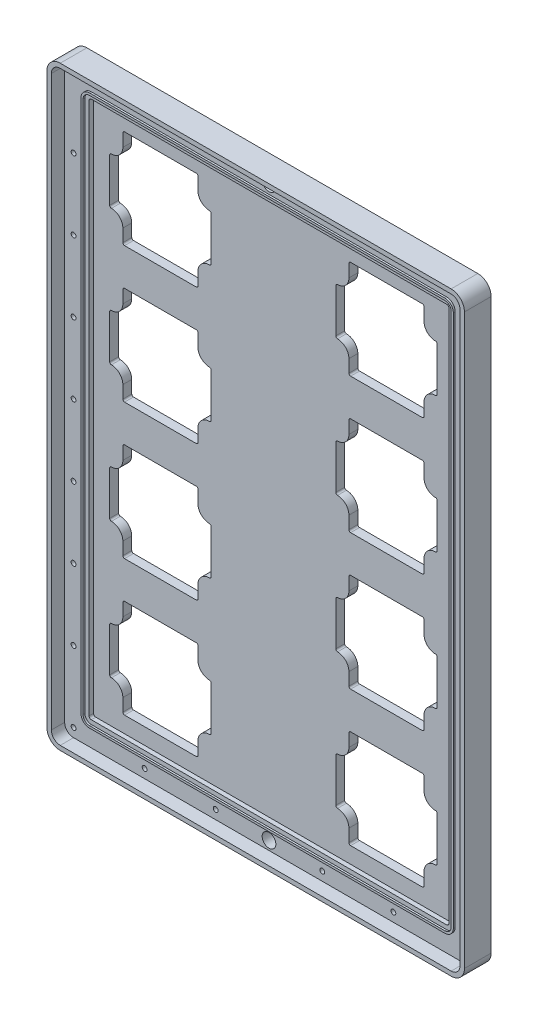
from build123d import *

# Parameters (mm, degrees)
SKETCH1_W            = 292.1
SKETCH1_H            = 419.1
BOSS_EXTRUDE1_DEPTH  = 9.525
SKETCH4_R            = 1.7272
CUT_EXTRUDE1_DEPTH   = 7.62
LPATTERN2_COUNT      = 8
LPATTERN2_PITCH      = 50.8
CUT_EXTRUDE3_DEPTH   = 3.175
BOSS_EXTRUDE2_DEPTH  = 1.3335
FILLET1_R            = 6.35
CUT_EXTRUDE5_DEPTH   = 3.175
CUT_EXTRUDE6_DEPTH   = 511.964898033
SKETCH11_R           = 1.1303
CUT_EXTRUDE7_DEPTH   = 3.96875
LPATTERN1_COUNT      = 2
LPATTERN1_PITCH      = 161.5948
LPATTERN1_COUNT_DIR2 = 4
LPATTERN1_PITCH_DIR2 = 96.8756
BOSS_EXTRUDE5_START  = -19.05
BOSS_EXTRUDE5_DEPTH  = 19.05
SKETCH14_R           = 1.7272
CUT_EXTRUDE8_DEPTH   = 7.62
SKETCH15_R           = 4.9022
CUT_EXTRUDE9_DEPTH   = 516.358348021
LPATTERN3_COUNT      = 2
LPATTERN3_PITCH      = 406.4


with BuildPart() as part:
    # Sketch1 → Boss-Extrude1 (new body)
    with BuildSketch(Plane.XY):
        with Locations((146.05, 209.55)):
            Rectangle(SKETCH1_W, SKETCH1_H)
    extrude(amount=BOSS_EXTRUDE1_DEPTH)

    # Sketch4 → Cut-Extrude1 (cut)
    with BuildSketch(Plane.XY.offset(9.525)):
        with Locations((6.35, 6.35)):
            Circle(SKETCH4_R)
        with Locations((6.35, 412.75)):
            Circle(SKETCH4_R)
        with Locations((285.75, 412.75)):
            Circle(SKETCH4_R)
        with Locations((285.75, 6.35)):
            Circle(SKETCH4_R)
    cut_extrude1 = extrude(amount=-CUT_EXTRUDE1_DEPTH, mode=Mode.SUBTRACT)

    # LPattern2: Cut-Extrude1 ×8
    with Locations(*[(0, -i * LPATTERN2_PITCH, 0) for i in range(1, LPATTERN2_COUNT)]):
        add(cut_extrude1, mode=Mode.SUBTRACT)

    # Sketch6 → Cut-Extrude3 (cut)
    with BuildSketch(Plane.XY.offset(9.525)):
        with BuildLine():
            Line((273.05, 401.6375), (19.05, 401.6375))
            ThreePointArc((19.05, 401.6375), (17.927467985, 401.172532015), (17.4625, 400.05))
            Line((17.4625, 400.05), (17.4625, 19.05))
            ThreePointArc((17.4625, 19.05), (17.927467985, 17.927467985), (19.05, 17.4625))
            Line((19.05, 17.4625), (273.05, 17.4625))
            ThreePointArc((273.05, 17.4625), (274.172532015, 17.927467985), (274.6375, 19.05))
            Line((274.6375, 19.05), (274.6375, 400.05))
            ThreePointArc((274.6375, 400.05), (274.172532015, 401.172532015), (273.05, 401.6375))
        make_face()
    extrude(amount=-CUT_EXTRUDE3_DEPTH, mode=Mode.SUBTRACT)

    # Sketch5 → Boss-Extrude2 (add)
    with BuildSketch(Plane.XY.offset(9.525)):
        with BuildLine():
            ThreePointArc((19.05, 406.146), (14.739477062, 404.360522938), (12.954, 400.05))
            Line((12.954, 400.05), (12.954, 19.05))
            ThreePointArc((12.954, 19.05), (14.739477062, 14.739477062), (19.05, 12.954))
            Line((19.05, 12.954), (273.05, 12.954))
            ThreePointArc((273.05, 12.954), (277.360522938, 14.739477062), (279.146, 19.05))
            Line((279.146, 19.05), (279.146, 400.05))
            ThreePointArc((279.146, 400.05), (277.360522938, 404.360522938), (273.05, 406.146))
            Line((273.05, 406.146), (19.05, 406.146))
        make_face()
        with BuildLine():
            ThreePointArc((273.05, 404.622), (276.282892204, 403.282892204), (277.622, 400.05))
            Line((277.622, 400.05), (277.622, 19.05))
            ThreePointArc((277.622, 19.05), (276.282892204, 15.817107796), (273.05, 14.478))
            Line((273.05, 14.478), (19.05, 14.478))
            ThreePointArc((19.05, 14.478), (15.817107796, 15.817107796), (14.478, 19.05))
            Line((14.478, 19.05), (14.478, 400.05))
            ThreePointArc((14.478, 400.05), (15.817107796, 403.282892204), (19.05, 404.622))
            Line((19.05, 404.622), (273.05, 404.622))
        make_face(mode=Mode.SUBTRACT)
    extrude(amount=BOSS_EXTRUDE2_DEPTH)

    # Fillet1
    fillet1_edges = [part.edges().sort_by_distance(p)[0] for p in [
        (0, 419.1, 4.7625),
        (292.1, 419.1, 4.7625),
        (0, 0, 4.7625),
        (292.1, 0, 4.7625),
    ]]
    fillet(fillet1_edges, radius=FILLET1_R)

    # Sketch8 → Cut-Extrude5 (cut)
    with BuildSketch(Plane(origin=(0, 0, 0), x_dir=(-1, 0, 0), z_dir=(0, 0, -1))):
        with BuildLine():
            Line((-201.2442, 393.7), (-252.4506, 393.7))
            ThreePointArc((-252.4506, 393.7), (-255.881057838, 392.279057838), (-257.302, 388.8486))
            Line((-257.302, 388.8486), (-257.302, 379.857))
            ThreePointArc((-257.302, 379.857), (-258.633668309, 376.642068309), (-261.8486, 375.3104))
            ThreePointArc((-261.8486, 375.3104), (-265.279057838, 373.889457838), (-266.7, 370.459))
            Line((-266.7, 370.459), (-266.7, 339.2678))
            ThreePointArc((-266.7, 339.2678), (-265.279057838, 335.837342162), (-261.8486, 334.4164))
            ThreePointArc((-261.8486, 334.4164), (-258.633668309, 333.084731691), (-257.302, 329.8698))
            Line((-257.302, 329.8698), (-257.302, 320.8782))
            ThreePointArc((-257.302, 320.8782), (-255.881057838, 317.447742162), (-252.4506, 316.0268))
            Line((-252.4506, 316.0268), (-201.2442, 316.0268))
            ThreePointArc((-201.2442, 316.0268), (-197.813742162, 317.447742162), (-196.3928, 320.8782))
            Line((-196.3928, 320.8782), (-196.3928, 329.8698))
            ThreePointArc((-196.3928, 329.8698), (-195.061131691, 333.084731691), (-191.8462, 334.4164))
            ThreePointArc((-191.8462, 334.4164), (-188.415742162, 335.837342162), (-186.9948, 339.2678))
            Line((-186.9948, 339.2678), (-186.9948, 370.459))
            ThreePointArc((-186.9948, 370.459), (-188.415742162, 373.889457838), (-191.8462, 375.3104))
            ThreePointArc((-191.8462, 375.3104), (-195.061131691, 376.642068309), (-196.3928, 379.857))
            Line((-196.3928, 379.857), (-196.3928, 388.8486))
            ThreePointArc((-196.3928, 388.8486), (-197.813742162, 392.279057838), (-201.2442, 393.7))
        make_face()
        with BuildLine():
            Line((-264.668, 370.459), (-264.668, 339.2678))
            ThreePointArc((-264.668, 339.2678), (-263.842216859, 337.274183141), (-261.8486, 336.4484))
            ThreePointArc((-261.8486, 336.4484), (-257.196827329, 334.521572671), (-255.27, 329.8698))
            Line((-255.27, 329.8698), (-255.27, 320.8782))
            ThreePointArc((-255.27, 320.8782), (-254.444216859, 318.884583141), (-252.4506, 318.0588))
            Line((-252.4506, 318.0588), (-201.2442, 318.0588))
            ThreePointArc((-201.2442, 318.0588), (-199.250583141, 318.884583141), (-198.4248, 320.8782))
            Line((-198.4248, 320.8782), (-198.4248, 329.8698))
            ThreePointArc((-198.4248, 329.8698), (-196.497972671, 334.521572671), (-191.8462, 336.4484))
            ThreePointArc((-191.8462, 336.4484), (-189.852583141, 337.274183141), (-189.0268, 339.2678))
            Line((-189.0268, 339.2678), (-189.0268, 370.459))
            ThreePointArc((-189.0268, 370.459), (-189.852583141, 372.452616859), (-191.8462, 373.2784))
            ThreePointArc((-191.8462, 373.2784), (-196.497972671, 375.205227329), (-198.4248, 379.857))
            Line((-198.4248, 379.857), (-198.4248, 388.8486))
            ThreePointArc((-198.4248, 388.8486), (-199.250583141, 390.842216859), (-201.2442, 391.668))
            Line((-201.2442, 391.668), (-252.4506, 391.668))
            ThreePointArc((-252.4506, 391.668), (-254.444216859, 390.842216859), (-255.27, 388.8486))
            Line((-255.27, 388.8486), (-255.27, 379.857))
            ThreePointArc((-255.27, 379.857), (-257.196827329, 375.205227329), (-261.8486, 373.2784))
            ThreePointArc((-261.8486, 373.2784), (-263.842216859, 372.452616859), (-264.668, 370.459))
        make_face(mode=Mode.SUBTRACT)
    cut_extrude5 = extrude(amount=-CUT_EXTRUDE5_DEPTH, mode=Mode.SUBTRACT)

    # Sketch10 → Cut-Extrude6 (cut, through all)
    with BuildSketch(Plane(origin=(0, 0, 0), x_dir=(-1, 0, 0), z_dir=(0, 0, -1))):
        with BuildLine():
            Line((-263.0805, 370.459), (-263.0805, 339.2678))
            ThreePointArc((-263.0805, 339.2678), (-262.719684844, 338.396715156), (-261.8486, 338.0359))
            ThreePointArc((-261.8486, 338.0359), (-256.074295314, 335.644104686), (-253.6825, 329.8698))
            Line((-253.6825, 329.8698), (-253.6825, 320.8782))
            ThreePointArc((-253.6825, 320.8782), (-253.321684844, 320.007115156), (-252.4506, 319.6463))
            Line((-252.4506, 319.6463), (-201.2442, 319.6463))
            ThreePointArc((-201.2442, 319.6463), (-200.373115156, 320.007115156), (-200.0123, 320.8782))
            Line((-200.0123, 320.8782), (-200.0123, 329.8698))
            ThreePointArc((-200.0123, 329.8698), (-197.620504686, 335.644104686), (-191.8462, 338.0359))
            ThreePointArc((-191.8462, 338.0359), (-190.975115156, 338.396715156), (-190.6143, 339.2678))
            Line((-190.6143, 339.2678), (-190.6143, 370.459))
            ThreePointArc((-190.6143, 370.459), (-190.975115156, 371.330084844), (-191.8462, 371.6909))
            ThreePointArc((-191.8462, 371.6909), (-197.620504686, 374.082695314), (-200.0123, 379.857))
            Line((-200.0123, 379.857), (-200.0123, 388.8486))
            ThreePointArc((-200.0123, 388.8486), (-200.373115156, 389.719684844), (-201.2442, 390.0805))
            Line((-201.2442, 390.0805), (-252.4506, 390.0805))
            ThreePointArc((-252.4506, 390.0805), (-253.321684844, 389.719684844), (-253.6825, 388.8486))
            Line((-253.6825, 388.8486), (-253.6825, 379.857))
            ThreePointArc((-253.6825, 379.857), (-256.074295314, 374.082695314), (-261.8486, 371.6909))
            ThreePointArc((-261.8486, 371.6909), (-262.719684844, 371.330084844), (-263.0805, 370.459))
        make_face()
    cut_extrude6 = extrude(amount=-CUT_EXTRUDE6_DEPTH, mode=Mode.SUBTRACT)

    # Sketch11 → Cut-Extrude7 (cut)
    with BuildSketch(Plane(origin=(0, 0, 0), x_dir=(-1, 0, 0), z_dir=(0, 0, -1))):
        with Locations((-261.8486, 388.8994)):
            Circle(SKETCH11_R)
        with Locations((-191.8462, 388.8994)):
            Circle(SKETCH11_R)
        with Locations((-191.8462, 320.8274)):
            Circle(SKETCH11_R)
        with Locations((-261.8486, 320.8274)):
            Circle(SKETCH11_R)
    cut_extrude7 = extrude(amount=-CUT_EXTRUDE7_DEPTH, mode=Mode.SUBTRACT)

    # LPattern1: Cut-Extrude5, Cut-Extrude6, Cut-Extrude7 2 × 4
    with Locations(*[(-i * LPATTERN1_PITCH, -j * LPATTERN1_PITCH_DIR2, 0) for i in range(LPATTERN1_COUNT) for j in range(LPATTERN1_COUNT_DIR2) if (i, j) != (0, 0)]):
        add(cut_extrude5, mode=Mode.SUBTRACT)
        add(cut_extrude6, mode=Mode.SUBTRACT)
        add(cut_extrude7, mode=Mode.SUBTRACT)

    # Sketch13 → Boss-Extrude5 (add)
    with BuildSketch(Plane(origin=(0, 0, 0), x_dir=(-1, 0, 0), z_dir=(0, 0, -1)).offset(BOSS_EXTRUDE5_START)):
        with BuildLine():
            Line((-285.75, -3.175), (-6.35, -3.175))
            ThreePointArc((-6.35, -3.175), (0.385192091, -0.385192091), (3.175, 6.35))
            Line((3.175, 6.35), (3.175, 412.75))
            ThreePointArc((3.175, 412.75), (0.385192091, 419.485192091), (-6.35, 422.275))
            Line((-6.35, 422.275), (-285.75, 422.275))
            ThreePointArc((-285.75, 422.275), (-292.485192091, 419.485192091), (-295.275, 412.75))
            Line((-295.275, 412.75), (-295.275, 6.35))
            ThreePointArc((-295.275, 6.35), (-292.485192091, -0.385192091), (-285.75, -3.175))
        make_face()
        with BuildLine():
            Line((-6.35, 419.1), (-285.75, 419.1))
            ThreePointArc((-285.75, 419.1), (-290.240128061, 417.240128061), (-292.1, 412.75))
            Line((-292.1, 412.75), (-292.1, 6.35))
            ThreePointArc((-292.1, 6.35), (-290.240128061, 1.859871939), (-285.75, 0))
            Line((-285.75, 0), (-6.35, 0))
            ThreePointArc((-6.35, 0), (-1.859871939, 1.859871939), (0, 6.35))
            Line((0, 6.35), (0, 412.75))
            ThreePointArc((0, 412.75), (-1.859871939, 417.240128061), (-6.35, 419.1))
        make_face(mode=Mode.SUBTRACT)
    extrude(amount=BOSS_EXTRUDE5_DEPTH)

    # Sketch14 → Cut-Extrude8 (cut)
    with BuildSketch(Plane.XY.offset(9.525)):
        with Locations((234.95, 6.35)):
            Circle(SKETCH14_R)
        with Locations((184.15, 6.35)):
            Circle(SKETCH14_R)
        with Locations((107.95, 6.35)):
            Circle(SKETCH14_R)
        with Locations((57.15, 6.35)):
            Circle(SKETCH14_R)
    cut_extrude8 = extrude(amount=-CUT_EXTRUDE8_DEPTH, mode=Mode.SUBTRACT)

    # Sketch15 → Cut-Extrude9 (cut, through all)
    with BuildSketch(Plane.XY.offset(9.525)):
        with Locations((146.05, 6.35)):
            Circle(SKETCH15_R)
    cut_extrude9 = extrude(amount=-CUT_EXTRUDE9_DEPTH, mode=Mode.SUBTRACT)

    # LPattern3: Cut-Extrude8, Cut-Extrude9 ×2
    with Locations(*[(0, i * LPATTERN3_PITCH, 0) for i in range(1, LPATTERN3_COUNT)]):
        add(cut_extrude8, mode=Mode.SUBTRACT)
        add(cut_extrude9, mode=Mode.SUBTRACT)


solid = part.part
